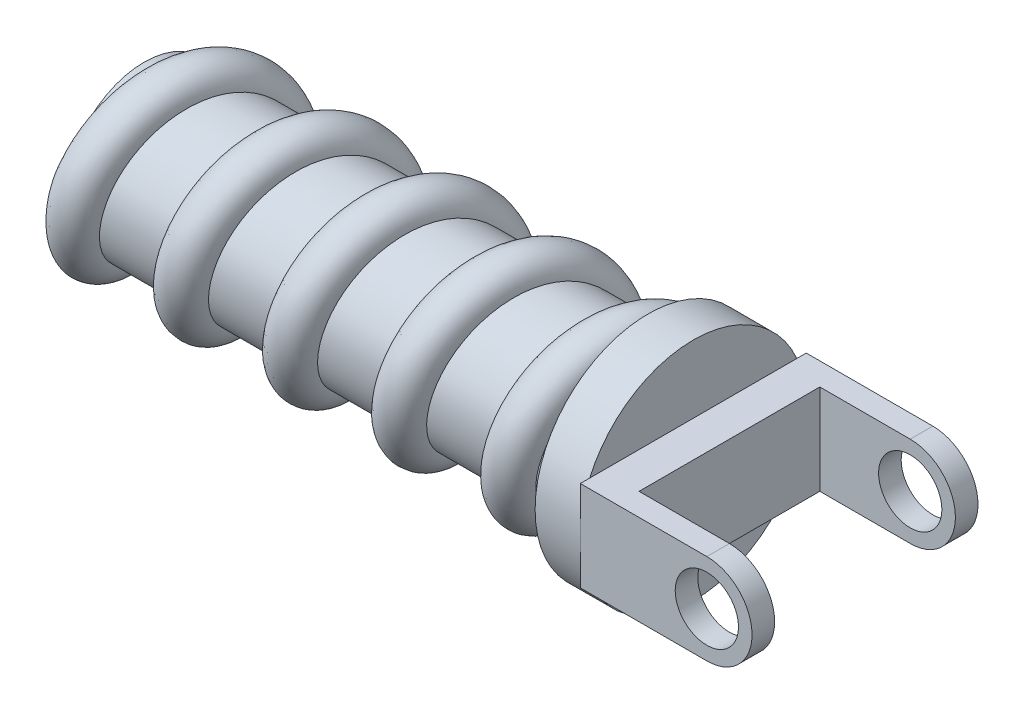
from build123d import *

# Parameters (mm, degrees)
SKETCH1_W               = 50.8
SKETCH1_H               = 5.08
BOSS_EXTRUDE1_DEPTH     = 7.62
SKETCH2_R               = 1.778
BOSS_EXTRUDE2_DEPTH     = 5.08
BOSS_EXTRUDE3_START     = 5.08
SKETCH3_R               = 1.778
BOSS_EXTRUDE3_DEPTH     = 5.08
SKETCH4_W               = 2.032
SKETCH4_H               = 5.08
BOSS_EXTRUDE4_DEPTH     = 2.54
BOSS_EXTRUDE5_DEPTH     = 1.27
SKETCH6_W               = 2.032
SKETCH6_H               = 5.08
BOSS_EXTRUDE6_DEPTH     = 2.54
BOSS_EXTRUDE7_START     = -1.27
BOSS_EXTRUDE7_DEPTH     = 1.27
SKETCH8_R               = 1.778
CUT_EXTRUDE1_DEPTH      = 61.588451045
CUT_EXTRUDE2_DEPTH      = 60.99994
CUT_EXTRUDE2_DEPTH_BACK = 60.99994
SKETCH9_W               = 48.768
SKETCH9_H               = 5.08
SKETCH10_R              = 6.35
BOSS_EXTRUDE8_DEPTH     = 2.54
SKETCH11_R              = 4.445
BOSS_EXTRUDE9_DEPTH     = 68.961
SWEEP1_PITCH            = 6.129777778
CUT_EXTRUDE4_DEPTH      = 27.94
CUT_EXTRUDE4_DEPTH_BACK = 27.94
SKETCH17_R              = 8.199428912
SKETCH18_R              = 9.943800803
CUT_EXTRUDE5_DEPTH      = 12.7


with BuildPart() as part:
    # Sketch1 → Boss-Extrude1 (new body)
    with BuildSketch(Plane.XY):
        with Locations((25.4, -2.54)):
            Rectangle(SKETCH1_W, SKETCH1_H)
    extrude(amount=BOSS_EXTRUDE1_DEPTH)

    # Sketch2 → Boss-Extrude2 (add)
    with BuildSketch(Plane.XY.offset(7.62)):
        with Locations((2.54, -2.54)):
            Circle(SKETCH2_R)
    extrude(amount=BOSS_EXTRUDE2_DEPTH)

    # Sketch3 → Boss-Extrude3 (add)
    with BuildSketch(Plane(origin=(0, 0, 0), x_dir=(-1, 0, 0), z_dir=(0, 0, -1)).offset(BOSS_EXTRUDE3_START)):
        with Locations(Location((-2.54, -2.54, 0), (0, 0, 180))):
            Circle(SKETCH3_R)
    extrude(amount=-BOSS_EXTRUDE3_DEPTH)

    # Sketch4 → Boss-Extrude4 (add)
    with BuildSketch(Plane.XY.offset(7.62)):
        with Locations((49.784, -2.54)):
            Rectangle(SKETCH4_W, SKETCH4_H)
    extrude(amount=BOSS_EXTRUDE4_DEPTH)

    # Sketch5 → Boss-Extrude5 (add)
    with BuildSketch(Plane.XY.offset(10.16)):
        with BuildLine():
            Line((50.8, 0), (55.88, 0))
            ThreePointArc((55.88, 0), (58.42, -2.54), (55.88, -5.08))
            Line((55.88, -5.08), (50.8, -5.08))
            Line((50.8, -5.08), (50.8, 0))
        make_face()
    extrude(amount=-BOSS_EXTRUDE5_DEPTH)

    # Sketch6 → Boss-Extrude6 (add)
    with BuildSketch(Plane(origin=(0, 0, 0), x_dir=(-1, 0, 0), z_dir=(0, 0, -1))):
        with Locations((-49.784, -2.54)):
            Rectangle(SKETCH6_W, SKETCH6_H)
    extrude(amount=BOSS_EXTRUDE6_DEPTH)

    # Sketch7 → Boss-Extrude7 (add)
    with BuildSketch(Plane(origin=(0, 0, -2.54), x_dir=(-1, 0, 0), z_dir=(0, 0, -1)).offset(BOSS_EXTRUDE7_START)):
        with BuildLine():
            Line((-48.768, 0), (-55.88, 0))
            ThreePointArc((-55.88, 0), (-58.42, -2.54), (-55.88, -5.08))
            Line((-55.88, -5.08), (-48.768, -5.08))
            Line((-48.768, -5.08), (-48.768, 0))
        make_face()
    extrude(amount=BOSS_EXTRUDE7_DEPTH)

    # Sketch8 → Cut-Extrude1 (cut, through all)
    with BuildSketch(Plane(origin=(0, 0, -2.54), x_dir=(-1, 0, 0), z_dir=(0, 0, -1))):
        with Locations((-55.88, -2.54)):
            Circle(SKETCH8_R)
    extrude(amount=-CUT_EXTRUDE1_DEPTH, mode=Mode.SUBTRACT)

    # Sketch9 → Cut-Extrude2 (cut, two sides: drawn at the far end of the back side and taken through both)
    with BuildSketch(Plane.XY.offset(7.62).offset(-CUT_EXTRUDE2_DEPTH_BACK)):
        with Locations((24.384, -2.54)):
            Rectangle(SKETCH9_W, SKETCH9_H)
    extrude(amount=CUT_EXTRUDE2_DEPTH + CUT_EXTRUDE2_DEPTH_BACK, mode=Mode.SUBTRACT)

    # Sketch10 → Boss-Extrude8 (add)
    with BuildSketch(Plane.ZY.offset(-48.768)):
        with Locations((3.81, -2.54)):
            Circle(SKETCH10_R)
    extrude(amount=BOSS_EXTRUDE8_DEPTH)

    # Sketch11 → Boss-Extrude9 (add)
    with BuildSketch(Plane.ZY.offset(-46.228)):
        with Locations((3.81, -2.54)):
            Circle(SKETCH11_R)
    extrude(amount=BOSS_EXTRUDE9_DEPTH)

    # Sweep1: the profile of Sweep1 profile screwed along a left-hand helix of 11.25 turns, 14 arcs to a turn; built about Z, then put on its axis
    sweep1_z = Axis((0, 0, 0), (0, 0, 1))
    sweep1_corners = [(4.445, -0.272258054, -1.240473922), (5.715, 0, 0), (4.445, 0.272258054, 1.240473922), (3.175, 0, 0)]
    with BuildLine(mode=Mode.PRIVATE) as sweep1_profile:
        ThreePointArc((4.445, -0.272258054, -1.240473922), (5.343025612, -0.192515516, -0.877147522), (5.715, 0, 0))
        ThreePointArc((5.715, 0, 0), (5.343025612, 0.192515516, 0.877147522), (4.445, 0.272258054, 1.240473922))
        ThreePointArc((4.445, 0.272258054, 1.240473922), (3.546974388, 0.192515516, 0.877147522), (3.175, 0, 0))
        ThreePointArc((3.175, 0, 0), (3.546974388, -0.192515516, -0.877147522), (4.445, -0.272258054, -1.240473922))
    sweep1_cap = Face(sweep1_profile.wire())
    sweep1_arcs = [((4.445, -0.272258054, -1.240473922), (5.715, -0.272258054, -1.240473922), (5.715, 0, 0), (1, 0.7071067811865476, 1)), ((5.715, 0, 0), (5.715, 0.272258054, 1.240473922), (4.445, 0.272258054, 1.240473922), (1, 0.7071067811865476, 1)), ((4.445, 0.272258054, 1.240473922), (3.175, 0.272258054, 1.240473922), (3.175, 0, 0), (1, 0.7071067811865476, 1)), ((3.175, 0, 0), (3.175, -0.272258054, -1.240473922), (4.445, -0.272258054, -1.240473922), (1, 0.7071067811865476, 1))]  # start, shoulder, end, weights
    sweep1_turn_angles = [0, -12.857142857, -25.714285714, -38.571428571, -51.428571429, -64.285714286, -77.142857143, -90, -102.857142857, -115.714285714, -128.571428571, -141.428571429, -154.285714286, -167.142857143, -180, -192.857142857, -205.714285714, -218.571428571, -231.428571429, -244.285714286, -257.142857143, -270, -282.857142857, -295.714285714, -308.571428571, -321.428571429, -334.285714286, -347.142857143, -360]
    sweep1_turn_weights = [1, 0.9749279121818236, 1, 0.9749279121818236, 1, 0.9749279121818236, 1, 0.9749279121818236, 1, 0.9749279121818236, 1, 0.9749279121818236, 1, 0.9749279121818236, 1, 0.9749279121818236, 1, 0.9749279121818236, 1, 0.9749279121818236, 1, 0.9749279121818236, 1, 0.9749279121818237, 1, 0.9749279121818236, 1, 0.9749279121818236, 1]
    sweep1_turn_sides = [Face.make_bezier_surface([[Vector(p[j][0], p[j][1], 0).rotate(sweep1_z, sweep1_turn_angles[2 * i + k]) / sweep1_turn_weights[2 * i + k] + Vector(0, 0, p[j][2] + -SWEEP1_PITCH * sweep1_turn_angles[2 * i + k] / 360) for k in range(3)] for j in range(3)], [[p[3][j] * sweep1_turn_weights[2 * i + k] for k in range(3)] for j in range(3)]) for p in sweep1_arcs for i in range(14)]
    sweep1_last_angles = [-3960, -3972.857142857, -3985.714285714, -3998.571428571, -4011.428571429, -4024.285714286, -4037.142857143, -4043.571428571, -4050]
    sweep1_last_weights = [1, 0.9749279121818235, 1, 0.9749279121818235, 1, 0.9749279121818235, 1, 0.9937122098932397, 1]
    sweep1_last_sides = [Face.make_bezier_surface([[Vector(p[j][0], p[j][1], 0).rotate(sweep1_z, sweep1_last_angles[2 * i + k]) / sweep1_last_weights[2 * i + k] + Vector(0, 0, p[j][2] + -SWEEP1_PITCH * sweep1_last_angles[2 * i + k] / 360) for k in range(3)] for j in range(3)], [[p[3][j] * sweep1_last_weights[2 * i + k] for k in range(3)] for j in range(3)]) for p in sweep1_arcs for i in range(4)]
    sweep1 = Plane(origin=(46.228, -2.54, 3.81), x_dir=(0, 0, -1), z_dir=(-1, 0, 0)) * Solid(Shell([*[p.moved(Location((0, 0, SWEEP1_PITCH * i))) for i in range(11) for p in sweep1_turn_sides], *sweep1_last_sides, sweep1_cap, sweep1_cap.rotate(sweep1_z, -4050).moved(Location((0, 0, -SWEEP1_PITCH * -4050 / 360)))]))
    add(sweep1)

    # Sketch17 → Cut-Extrude4 (cut, two sides: drawn at the far end of the back side and taken through both)
    with BuildSketch(Plane.ZY.offset(22.733).offset(-CUT_EXTRUDE4_DEPTH_BACK)):
        with Locations((3.648564455, -2.569066224)):
            Circle(SKETCH17_R)
    extrude(amount=CUT_EXTRUDE4_DEPTH + CUT_EXTRUDE4_DEPTH_BACK, mode=Mode.SUBTRACT)

    # Sketch18 → Cut-Extrude5 (cut)
    with BuildSketch(Plane.ZY.offset(-5.207)):
        with Locations((3.81, -2.54)):
            Circle(SKETCH18_R)
    extrude(amount=-CUT_EXTRUDE5_DEPTH, mode=Mode.SUBTRACT)


solid = part.part
